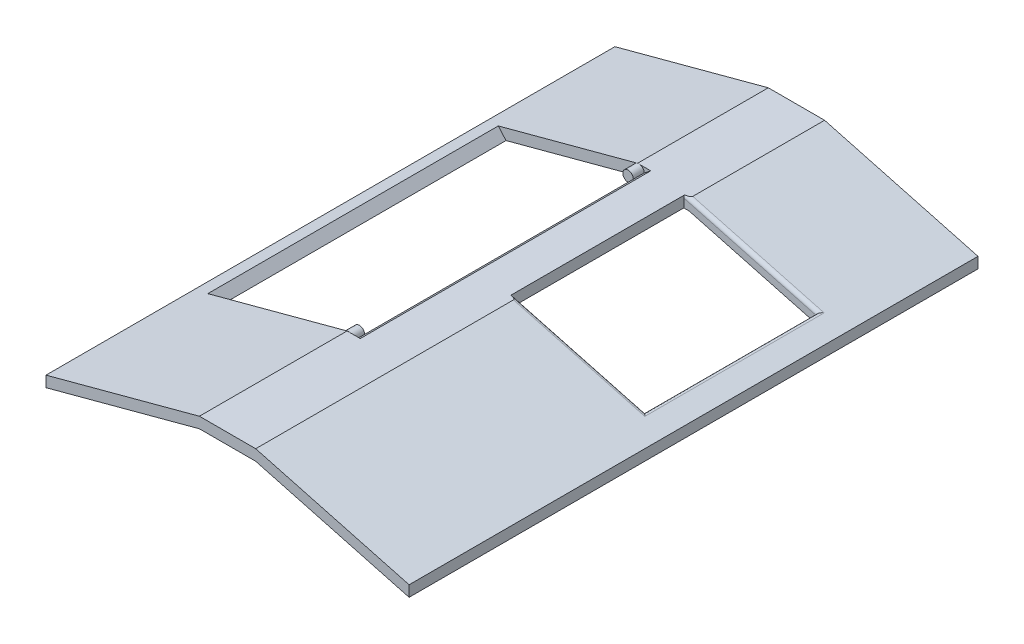
from build123d import *

# Parameters (mm, degrees)
AUFSATZ_LINEAR_AUSTRAGEN1_DEPTH = 1566.7
SCHNITT_LINEAR_AUSTRAGEN1_REACH = 1704.359
FASE1_SIZE2                     = 30
FASE1_SIZE                      = 22
VERRUNDUNG1_R                   = 10
SKIZZE4_R                       = 14.488887394336269
AUFSATZ_LINEAR_AUSTRAGEN3_DEPTH = 30
AUFSATZ_LINEAR_AUSTRAGEN7_REACH = 1402.712
LINEARES_MUSTER2_COUNT          = 2
LINEARES_MUSTER2_PITCH          = 770.0000000000005


with BuildPart() as part:
    # Skizze1 → Aufsatz-Linear austragen1 (new body)
    with BuildSketch(Plane.XY):
        Polygon((650.3604764885325, 174.22108378429925), (650.3604764885325, 144.22108378429925), (227.86047648853256, 257.42961758644554), (72.86047648853256, 257.42961758644554), (-349.6395235114674, 144.22108378429914), (-349.6395235114674, 174.2210837842995), (72.86047648853253, 287.42961758644606), (227.8604764885318, 287.42961758644606), align=None)
    extrude(amount=AUFSATZ_LINEAR_AUSTRAGEN1_DEPTH)

    # Skizze2 → Schnitt-Linear austragen1 (cut, up to next)
    with BuildSketch(Plane(origin=(0, 287.42961758644606, 0), x_dir=(1, 0, 0), z_dir=(0, 1, 0)), mode=Mode.PRIVATE) as schnitt_linear_austragen1_sk1:
        Polygon((145.36047648853253, -360), (-289.47952351146745, -360.00000000000006), (-289.47952351146733, -1160.0000000000002), (145.36047648853264, -1160.0000000000005), align=None)
    schnitt_linear_austragen1_tool1 = extrude(schnitt_linear_austragen1_sk1.sketch, amount=-SCHNITT_LINEAR_AUSTRAGEN1_REACH, mode=Mode.PRIVATE) & part.part
    # Skizze2 → Schnitt-Linear austragen1 (cut, up to next)
    with BuildSketch(Plane(origin=(0, 287.42961758644606, 0), x_dir=(1, 0, 0), z_dir=(0, 1, 0)), mode=Mode.PRIVATE) as schnitt_linear_austragen1_sk2:
        Polygon((213.10047648853242, -373), (577.1204764885325, -372.99999999999994), (577.1204764885326, -847), (213.10047648853248, -847.0000000000001), align=None)
    schnitt_linear_austragen1_tool2 = extrude(schnitt_linear_austragen1_sk2.sketch, amount=-SCHNITT_LINEAR_AUSTRAGEN1_REACH, mode=Mode.PRIVATE) & part.part
    add(schnitt_linear_austragen1_tool1.solids().sort_by_distance((-72.059524, 287.429618, 760))[0], mode=Mode.SUBTRACT)
    add(schnitt_linear_austragen1_tool2.solids().sort_by_distance((395.110476, 287.429618, 610))[0], mode=Mode.SUBTRACT)

    # Fase1
    fase1_edges = [part.edges().sort_by_distance(p)[0] for p in [
        (-289.47952351146745, 190.34090720095548, 760.0000000000001),
    ]]
    fase1_side = [part.faces().sort_by_distance(p)[0] for p in [
        (-289.90453087503465, 190.22702682111037, 760.0000000000001),
    ]]
    chamfer(fase1_edges, length=FASE1_SIZE - 0.0001, length2=FASE1_SIZE2 - 0.0001, reference=fase1_side[0])  # a hair under: the kernel refuses the full size

    # Verrundung1
    verrundung1_edges = [part.edges().sort_by_distance(p)[0] for p in [
        (402.49047648853224, 240.6376501122001, 847),
    ]]
    fillet(verrundung1_edges, radius=VERRUNDUNG1_R)
    verrundung1_2_edges = [part.edges().sort_by_distance(p)[0] for p in [
        (577.1204764885325, 193.84568263795418, 610),
    ]]
    fillet(verrundung1_2_edges, radius=VERRUNDUNG1_R - 0.0001)  # a hair under: the kernel refuses the full size
    verrundung1_3_edges = [part.edges().sort_by_distance(p)[0] for p in [
        (402.4904764885322, 240.6376501122001, 373),
    ]]
    fillet(verrundung1_3_edges, radius=VERRUNDUNG1_R)

    # Skizze4 → Aufsatz-Linear austragen3 (add)
    with BuildSketch(Plane(origin=(-5.9234e-13, 0, 1160.0000000000005), x_dir=(-1, 0, -5.1e-16), z_dir=(5.1e-16, 0, -1))):
        with Locations(Location((-76.61047648853322, 273.43442705806245, 0), (0, 0, 105))):
            Circle(SKIZZE4_R)
    aufsatz_linear_austragen3 = extrude(amount=AUFSATZ_LINEAR_AUSTRAGEN3_DEPTH)

    # Aufsatz-Linear austragen7: up to this face of the body (flat: up to its plane)
    aufsatz_linear_austragen7_end = Plane(part.part.faces().sort_by_distance((-85.378398687, 228.495263502, 1160))[0])
    # Skizze6 → Aufsatz-Linear austragen7 (add, up to the picked face)
    with BuildSketch(Plane.XY.offset(360), mode=Mode.PRIVATE) as aufsatz_linear_austragen7_sk1:
        with BuildLine():
            Line((145.36047648853247, 287.42961758644606), (145.36047648853247, 257.42961758644554))
            Line((145.36047648853247, 257.42961758644554), (84.35616614086427, 257.42961758644554))
            Line((84.35616614086427, 257.42961758644554), (84.35616614086427, 261.189748632905))
            ThreePointArc((84.35616614086427, 261.189748632905), (89.30209346766217, 266.44509830768715), (91.09936388286874, 273.43442705806245))
            Line((91.09936388286874, 273.43442705806245), (109.11047648853247, 287.42961758644606))
            Line((109.11047648853247, 287.42961758644606), (145.36047648853247, 287.42961758644606))
        make_face()
    aufsatz_linear_austragen7_tool1 = split(extrude(aufsatz_linear_austragen7_sk1.sketch, amount=AUFSATZ_LINEAR_AUSTRAGEN7_REACH, mode=Mode.PRIVATE), bisect_by=aufsatz_linear_austragen7_end, keep=Keep.BOTH, mode=Mode.PRIVATE)
    add(aufsatz_linear_austragen7_tool1.solids().sort_by(Axis((118.992611, 271.244941, 360), (0, 0, 1)))[0])

    # Lineares Muster2: Aufsatz-Linear austragen3 ×2
    with Locations(*[(0, 0, -i * LINEARES_MUSTER2_PITCH) for i in range(1, LINEARES_MUSTER2_COUNT)]):
        add(aufsatz_linear_austragen3)


solid = part.part
